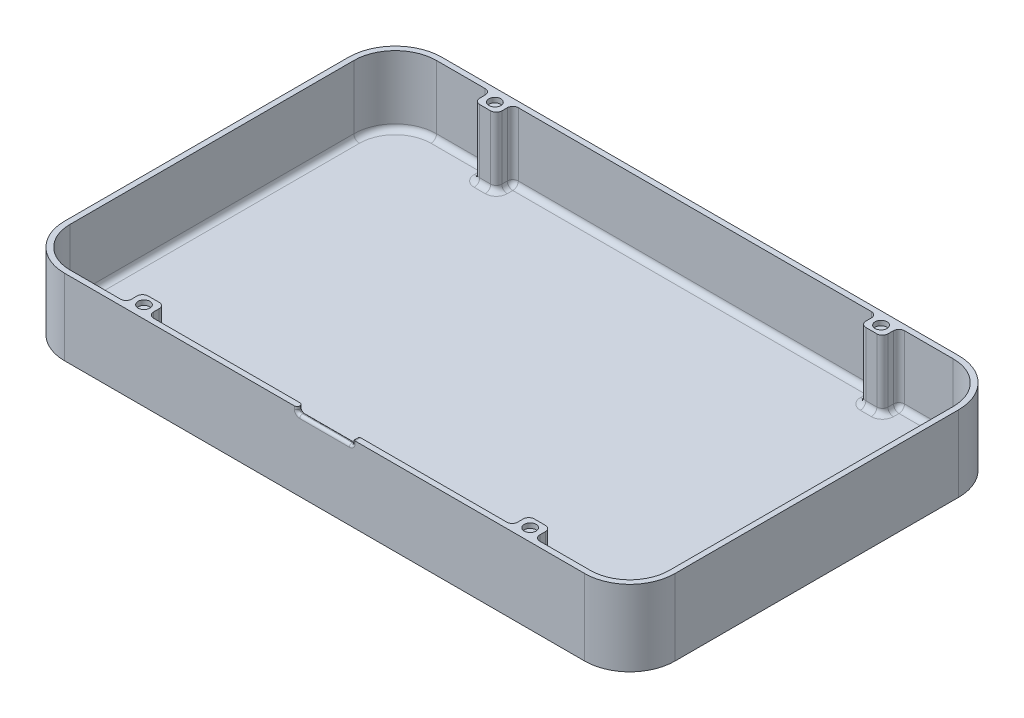
from build123d import *

# Parameters (mm, degrees)
SKETCH1_W                = 201.28
SKETCH1_H                = 116.21
BOSS_EXTRUDE1_DEPTH      = 2.5
FILLET1_R                = 6.98
FILLET2_R                = 6.35
BOSS_EXTRUDE3_DEPTH      = 2.5
BOSS_EXTRUDE4_DEPTH      = 25
CUT_EXTRUDE2_DEPTH       = 25
SKETCH6_W                = 8
SKETCH6_H                = 8
BOSS_EXTRUDE5_DEPTH      = 25
SKETCH7_R                = 2.15
CUT_EXTRUDE3_DEPTH       = 1.75
SKETCH9_R                = 2.15
CUT_EXTRUDE4_DEPTH       = 1.75
FILLET3_R                = 2
FILLET4_R                = 2
FILLET3_OF_MIRROR5_R     = 2
FILLET4_OF_MIRROR5_R     = 2
SKETCH10_W               = 20
SKETCH10_H               = 2
CUT_EXTRUDE5_DEPTH       = 2
FILLET5_R                = 1
FILLET6_R                = 2
CUT_EXTRUDE7_START       = -0.45
CUT_EXTRUDE7_OUTLINE_R   = 5.190797436
CUT_EXTRUDE7_DEPTH       = 0.45
CUT_EXTRUDE8_START       = -0.45
CUT_EXTRUDE8_OUTLINE_W   = 5.775616108
CUT_EXTRUDE8_OUTLINE_H   = 32.832520325
CUT_EXTRUDE8_OUTLINE_H_2 = 20.344721798
CUT_EXTRUDE8_DEPTH       = 0.45


# Read off the part's stored shape, not the designer's step: Cut-Extrude7, Cut-Extrude8
with BuildPart() as part:
    # Sketch1 → Boss-Extrude1 (new body)
    with BuildSketch(Plane(origin=(0, 0, 0), x_dir=(1, 0, 0), z_dir=(0, 1, 0))):
        with Locations((-100.64, 58.105)):
            Rectangle(SKETCH1_W, SKETCH1_H)
    extrude(amount=-BOSS_EXTRUDE1_DEPTH)

    # Fillet1
    fillet1_edges = [part.edges().sort_by_distance(p)[0] for p in [
        (-201.28, -1.25, -116.21),
        (0, -1.25, -116.21),
    ]]
    fillet(fillet1_edges, radius=FILLET1_R)

    # Fillet2
    fillet2_edges = [part.edges().sort_by_distance(p)[0] for p in [
        (0, -1.25, 0),
        (-201.28, -1.25, 0),
    ]]
    fillet(fillet2_edges, radius=FILLET2_R)

    # Sketch2 → Boss-Extrude3 (add)
    with BuildSketch(Plane(origin=(0, -2.5, 0), x_dir=(-1, 0, 0), z_dir=(0, -1, 0))):
        with BuildLine():
            Line((6.35, -10), (194.93, -10))
            ThreePointArc((194.93, -10), (206.491195872, -5.211195872), (211.28, 6.35))
            Line((211.28, 6.35), (211.28, 109.23))
            ThreePointArc((211.28, 109.23), (206.306673145, 121.236673145), (194.3, 126.21))
            Line((194.3, 126.21), (6.98, 126.21))
            ThreePointArc((6.98, 126.21), (-5.026673145, 121.236673145), (-10, 109.23))
            Line((-10, 109.23), (-10, 6.35))
            ThreePointArc((-10, 6.35), (-5.211195872, -5.211195872), (6.35, -10))
        make_face()
        with BuildLine():
            Line((6.35, 0), (194.93, 0))
            ThreePointArc((194.93, 0), (199.420128061, 1.859871939), (201.28, 6.35))
            Line((201.28, 6.35), (201.28, 109.23))
            ThreePointArc((201.28, 109.23), (199.235605333, 114.165605333), (194.3, 116.21))
            Line((194.3, 116.21), (6.98, 116.21))
            ThreePointArc((6.98, 116.21), (2.044394667, 114.165605333), (0, 109.23))
            Line((0, 109.23), (0, 6.35))
            ThreePointArc((0, 6.35), (1.859871939, 1.859871939), (6.35, 0))
        make_face(mode=Mode.SUBTRACT)
    extrude(amount=-BOSS_EXTRUDE3_DEPTH)

    # Sketch4 → Boss-Extrude4 (add)
    with BuildSketch(Plane(origin=(0, 0, 0), x_dir=(1, 0, 0), z_dir=(0, 1, 0))):
        with BuildLine():
            Line((10, 6.35), (10, 109.23))
            ThreePointArc((10, 109.23), (5.026673145, 121.236673145), (-6.98, 126.21))
            Line((-6.98, 126.21), (-194.3, 126.21))
            ThreePointArc((-194.3, 126.21), (-206.306673145, 121.236673145), (-211.28, 109.23))
            Line((-211.28, 109.23), (-211.28, 6.35))
            ThreePointArc((-211.28, 6.35), (-206.491195872, -5.211195872), (-194.93, -10))
            Line((-194.93, -10), (-6.35, -10))
            ThreePointArc((-6.35, -10), (5.211195872, -5.211195872), (10, 6.35))
        make_face()
    extrude(amount=BOSS_EXTRUDE4_DEPTH)

    # Sketch5 → Cut-Extrude2 (cut)
    with BuildSketch(Plane(origin=(0, 25, 0), x_dir=(1, 0, 0), z_dir=(0, 1, 0))):
        with BuildLine():
            Line((8, 6.35), (8, 109.23))
            ThreePointArc((8, 109.23), (3.612459582, 119.822459582), (-6.98, 124.21))
            Line((-6.98, 124.21), (-194.3, 124.21))
            ThreePointArc((-194.3, 124.21), (-204.892459582, 119.822459582), (-209.28, 109.23))
            Line((-209.28, 109.23), (-209.28, 6.35))
            ThreePointArc((-209.28, 6.35), (-205.07698231, -3.79698231), (-194.93, -8))
            Line((-194.93, -8), (-6.35, -8))
            ThreePointArc((-6.35, -8), (3.79698231, -3.79698231), (8, 6.35))
        make_face()
    extrude(amount=-CUT_EXTRUDE2_DEPTH, mode=Mode.SUBTRACT)

    # Sketch6 → Boss-Extrude5 (add)
    with BuildSketch(Plane(origin=(0, 0, 0), x_dir=(1, 0, 0), z_dir=(0, 1, 0))):
        with Locations((-170.64, -6)):
            Rectangle(SKETCH6_W, SKETCH6_H)
        with Locations((-170.64, 122.21)):
            Rectangle(SKETCH6_W, SKETCH6_H)
    boss_extrude5 = extrude(amount=BOSS_EXTRUDE5_DEPTH)

    # Sketch7 → Cut-Extrude3 (cut)
    with BuildSketch(Plane(origin=(0, 25, 0), x_dir=(1, 0, 0), z_dir=(0, 1, 0))):
        with Locations(Location((-170.64, 121.71, 0), (0, 0, 270))):
            Circle(SKETCH7_R)
    cut_extrude3 = extrude(amount=-CUT_EXTRUDE3_DEPTH, mode=Mode.SUBTRACT)

    # Sketch9 → Cut-Extrude4 (cut)
    with BuildSketch(Plane(origin=(0, 25, 0), x_dir=(1, 0, 0), z_dir=(0, 1, 0))):
        with Locations(Location((-170.64, -5.5, 0), (0, 0, 270))):
            Circle(SKETCH9_R)
    cut_extrude4 = extrude(amount=-CUT_EXTRUDE4_DEPTH, mode=Mode.SUBTRACT)

    # Fillet3
    fillet3_edges = [part.edges().sort_by_distance(p)[0] for p in [
        (-166.64, 12.5, -124.21),
        (-174.64, 12.5, -124.21),
        (-166.64, 12.5, -118.21),
        (-174.64, 12.5, -118.21),
    ]]
    fillet(fillet3_edges, radius=FILLET3_R)

    # Fillet4
    fillet4_edges = [part.edges().sort_by_distance(p)[0] for p in [
        (-166.64, 12.5, 8),
        (-174.64, 12.5, 8),
        (-174.64, 12.5, 2),
        (-166.64, 12.5, 2),
    ]]
    fillet(fillet4_edges, radius=FILLET4_R)

    # Mirror5: Boss-Extrude5, Cut-Extrude3, Cut-Extrude4 across plane
    add(boss_extrude5.mirror(Plane(origin=(-100.64, 0, 0), x_dir=(0, 0, 1), z_dir=(1, 0, 0))))
    add(cut_extrude3.mirror(Plane(origin=(-100.64, 0, 0), x_dir=(0, 0, 1), z_dir=(1, 0, 0))), mode=Mode.SUBTRACT)
    add(cut_extrude4.mirror(Plane(origin=(-100.64, 0, 0), x_dir=(0, 0, 1), z_dir=(1, 0, 0))), mode=Mode.SUBTRACT)

    # Fillet3 of Mirror5
    fillet3_of_mirror5_edges = [part.edges().sort_by_distance(p)[0] for p in [
        (-34.64, 12.5, -124.21),
        (-26.64, 12.5, -124.21),
        (-34.64, 12.5, -118.21),
        (-26.64, 12.5, -118.21),
    ]]
    fillet(fillet3_of_mirror5_edges, radius=FILLET3_OF_MIRROR5_R)

    # Fillet4 of Mirror5
    fillet4_of_mirror5_edges = [part.edges().sort_by_distance(p)[0] for p in [
        (-34.64, 12.5, 8),
        (-26.64, 12.5, 8),
        (-26.64, 12.5, 2),
        (-34.64, 12.5, 2),
    ]]
    fillet(fillet4_of_mirror5_edges, radius=FILLET4_OF_MIRROR5_R)

    # Sketch10 → Cut-Extrude5 (cut)
    with BuildSketch(Plane(origin=(0, 25, 0), x_dir=(1, 0, 0), z_dir=(0, 1, 0))):
        with Locations((-100.64, -9)):
            Rectangle(SKETCH10_W, SKETCH10_H)
    extrude(amount=-CUT_EXTRUDE5_DEPTH, mode=Mode.SUBTRACT)

    # Fillet5
    fillet5_edges = [part.edges().sort_by_distance(p)[0] for p in [
        (-110.64, 23, 9),
        (-110.64, 24, 10),
        (-100.64, 23, 8),
        (-110.64, 24, 8),
        (-90.64, 23, 9),
        (-90.64, 24, 8),
        (-100.64, 23, 10),
        (-90.64, 24, 10),
        (-90.64, 25, 9),
    ]]
    fillet(fillet5_edges, radius=FILLET5_R - 0.0001)  # a hair under: the kernel refuses the full size

    # Fillet6
    fillet6_edges = [part.edges().sort_by_distance(p)[0] for p in [
        (-185.785, 0, 8),
        (-205.07698231, 0, 3.79698231),
        (-209.28, 0, -57.79),
        (-204.892459582, 0, -119.822459582),
        (-15.81, 0, -124.21),
        (3.612459582, 0, -119.822459582),
        (8, 0, -57.79),
        (-174.64, 0, -121.21),
        (-170.64, 0, -118.21),
        (-185.47, 0, -124.21),
        (-166.64, 0, -121.21),
        (-166.054213562, 0, -123.624213562),
        (-175.225786438, 0, -123.624213562),
        (-174.054213562, 0, -118.795786438),
        (-167.225786438, 0, -118.795786438),
        (-174.64, 0, 5),
        (-170.64, 0, 2),
        (-166.64, 0, 5),
        (-100.64, 0, 8),
        (-166.054213562, 0, 7.414213562),
        (-175.225786438, 0, 7.414213562),
        (-174.054213562, 0, 2.585786438),
        (-167.225786438, 0, 2.585786438),
        (-26.64, 0, -121.21),
        (-30.64, 0, -118.21),
        (-34.64, 0, -121.21),
        (-100.64, 0, -124.21),
        (-35.225786438, 0, -123.624213562),
        (-26.054213562, 0, -123.624213562),
        (-27.225786438, 0, -118.795786438),
        (-34.054213562, 0, -118.795786438),
        (-15.495, 0, 8),
        (-26.64, 0, 5),
        (-34.64, 0, 5),
        (-30.64, 0, 2),
        (-35.225786438, 0, 7.414213562),
        (-26.054213562, 0, 7.414213562),
        (-27.225786438, 0, 2.585786438),
        (-34.054213562, 0, 2.585786438),
        (3.79698231, 0, 3.79698231),
    ]]
    fillet(fillet6_edges, radius=FILLET6_R)

    # Cut-Extrude7 outline → Cut-Extrude7 (cut)
    with BuildSketch(Plane.XZ.offset(2.5).offset(CUT_EXTRUDE7_START)):
        with BuildLine():
            add(Edge.make_bspline(
                [(-135.335021069, -68.509429841), (-136.902942436, -67.967883827), (-138.138308084, -66.510804787)],
                knots=[0.471458165, 0.471458165, 0.471458165, 1, 1, 1], degree=2))
            ThreePointArc((-135.335021069, -68.509429841), (-122.182388188, -58.219638212), (-135.304911995, -47.89147611))
            add(Edge.make_bspline(
                [(-135.304911995, -47.89147611), (-137.037610151, -48.257830638), (-138.138308084, -49.594184915)],
                knots=[0, 0, 0, 1, 1, 1], degree=2))
            Line((-138.138308084, -49.594184915), (-138.138308084, -48.055987377))
            Line((-138.138308084, -48.055987377), (-143.499525592, -48))
            Line((-143.499525592, -48), (-143.499525592, -68.305651136))
            Line((-143.499525592, -68.305651136), (-138.138308084, -68.305651136))
            Line((-138.138308084, -68.305651136), (-138.138308084, -66.510804787))
        make_face()
        with Locations((-132.910364857, -58.178026107)):
            Circle(CUT_EXTRUDE7_OUTLINE_R, mode=Mode.SUBTRACT)
    extrude(amount=CUT_EXTRUDE7_DEPTH, mode=Mode.SUBTRACT)

    # Cut-Extrude8 outline → Cut-Extrude8 (cut)
    # profile 1 of 7: a face of its own
    with BuildSketch(Plane.XZ.offset(2.5).offset(CUT_EXTRUDE8_START)):
        with BuildLine():
            Line((-153.895284553, -49.686686992), (-154.125689787, -49.461458333))
            add(Edge.make_bspline(
                [(-154.125689787, -49.461458333), (-154.333312342, -49.277271532), (-154.73497788, -48.920944683), (-155.384487301, -48.481747367), (-156.045267971, -48.142829792), (-156.721127319, -47.917706071), (-157.393020794, -47.77449684), (-158.050742932, -47.66904282), (-158.696238638, -47.605292289), (-159.122361376, -47.608176561), (-159.332848359, -47.6097099)],
                knots=[0, 0, 0, 0, 0.14624792, 0.282930482, 0.412301175, 0.536684676, 0.657355034, 0.774278195, 0.887941275, 0.998886329, 0.998886329, 0.998886329, 0.998886329], degree=3))
            add(Edge.make_bspline(
                [(-159.332848359, -47.6097099), (-159.695257047, -47.620844346), (-160.414247039, -47.642855132), (-161.478426635, -47.785641026), (-162.511050356, -48.037539669), (-163.51273552, -48.37519474), (-164.478530924, -48.799443636), (-165.383913378, -49.3368487), (-166.251254093, -49.941576965), (-166.771876888, -50.419833231), (-167.033495935, -50.660162602)],
                knots=[0, 0, 0, 0, 0.128061852, 0.254064318, 0.378555642, 0.503075247, 0.627217234, 0.750462499, 0.874604486, 1, 1, 1, 1], degree=3))
            add(Edge.make_bspline(
                [(-167.033495935, -50.660162602), (-167.275083253, -50.920153984), (-167.753245981, -51.434743037), (-168.374002255, -52.28126438), (-168.898668434, -53.175484814), (-169.347125364, -54.106030348), (-169.686619543, -55.076441077), (-169.946136959, -56.06921193), (-170.098116552, -57.090165798), (-170.118937903, -57.779458069), (-170.129430894, -58.126829268)],
                knots=[0, 0, 0, 0, 0.128388323, 0.254113136, 0.37901229, 0.503276211, 0.627383917, 0.750532671, 0.874280086, 1, 1, 1, 1], degree=3))
            add(Edge.make_bspline(
                [(-170.129430894, -58.126829268), (-170.11899702, -58.474216491), (-170.098292975, -59.163540559), (-169.945133687, -60.186341912), (-169.688050051, -61.181968268), (-169.345518404, -62.155568354), (-168.899173091, -63.091301178), (-168.372255424, -63.992628152), (-167.753812481, -64.851309562), (-167.275200179, -65.374704463), (-167.033495935, -65.63902439)],
                knots=[0, 0, 0, 0, 0.125145805, 0.248328119, 0.371671333, 0.495212293, 0.61961469, 0.744616561, 0.871028678, 1, 1, 1, 1], degree=3))
            add(Edge.make_bspline(
                [(-167.033495935, -65.63902439), (-166.776187157, -65.883388974), (-166.264594334, -66.369245571), (-165.411457542, -66.990779233), (-164.508114148, -67.531913326), (-163.547030411, -67.970119392), (-162.54087271, -68.317628359), (-161.501152685, -68.56124905), (-160.43010275, -68.71811497), (-159.70613274, -68.737926144), (-159.339186992, -68.74796748)],
                knots=[0, 0, 0, 0, 0.124863035, 0.248258272, 0.37082862, 0.495193376, 0.619551099, 0.745119547, 0.870813298, 1, 1, 1, 1], degree=3))
            add(Edge.make_bspline(
                [(-159.339186992, -68.74796748), (-159.098233335, -68.741442242), (-158.6232666, -68.728579723), (-157.920002587, -68.634359669), (-157.234193034, -68.481727747), (-156.573684206, -68.248630614), (-155.925913249, -67.969407759), (-155.303514118, -67.617138371), (-154.701609793, -67.19690446), (-154.322271787, -66.879868241), (-154.129430894, -66.718699187)],
                knots=[0, 0, 0, 0, 0.126308856, 0.248979433, 0.37141804, 0.494004315, 0.615659408, 0.740868788, 0.868267631, 1, 1, 1, 1], degree=3))
            Line((-154.129430894, -66.718699187), (-153.895284553, -66.53624873))
            Line((-153.895284553, -66.53624873), (-153.895284553, -80.858530234))
            Line((-153.895284553, -80.858530234), (-148.535928608, -80.858530234))
            Line((-148.535928608, -80.858530234), (-148.535928608, -48.06504065))
            Line((-148.535928608, -48.06504065), (-153.895284553, -48.06504065))
            Line((-153.895284553, -48.06504065), (-153.895284553, -49.686686992))
        make_face()
        with BuildLine():
            add(Edge.make_bspline(
                [(-164.770081301, -58.126829268), (-164.760316498, -57.950904711), (-164.740926284, -57.60156692), (-164.655373424, -57.089620397), (-164.52575302, -56.599239645), (-164.348121474, -56.129930789), (-164.119751135, -55.685381599), (-163.851889919, -55.255495568), (-163.530105473, -54.852947303), (-163.168229264, -54.473025878), (-162.776600068, -54.120966141), (-162.347767411, -53.821089297), (-161.898632309, -53.561937817), (-161.431423855, -53.337066778), (-160.939471941, -53.168745794), (-160.427375075, -53.046339235), (-159.892684639, -52.958013874), (-159.525986618, -52.93950825), (-159.339186992, -52.930081301)],
                knots=[0, 0, 0, 0, 0.063512842, 0.126119038, 0.186815983, 0.246214583, 0.306714762, 0.366809304, 0.428604473, 0.492213517, 0.555918619, 0.618186944, 0.680553391, 0.742816805, 0.80488842, 0.867665305, 0.932587388, 1, 1, 1, 1], degree=3))
            add(Edge.make_bspline(
                [(-159.339186992, -52.930081301), (-159.152348434, -52.939386398), (-158.785573985, -52.957652821), (-158.249353829, -53.048053234), (-157.732521455, -53.164985369), (-157.243840587, -53.347495156), (-156.769585255, -53.558940127), (-156.324184425, -53.828565149), (-155.896952068, -54.134038226), (-155.503664294, -54.485975085), (-155.139754414, -54.866520261), (-154.819947924, -55.275315652), (-154.552357425, -55.711593006), (-154.32144857, -56.163971881), (-154.149472604, -56.644341643), (-154.007624103, -57.140466749), (-153.92642804, -57.651059178), (-153.906590014, -57.995202288), (-153.897485992, -58.163927762)],
                knots=[0, 0, 0, 0, 0.066807777, 0.131147369, 0.194114214, 0.255887083, 0.317264953, 0.379464114, 0.441624642, 0.504758173, 0.567796508, 0.629647103, 0.689859339, 0.750508838, 0.810825709, 0.871929, 0.934738278, 0.99511549, 0.99511549, 0.99511549, 0.99511549], degree=3))
            add(Edge.make_bspline(
                [(-153.897485992, -58.163927762), (-153.906454184, -58.33396152), (-153.926010164, -58.679430985), (-154.008712508, -59.19309619), (-154.148009442, -59.692144681), (-154.323022266, -60.175672969), (-154.552121848, -60.63304935), (-154.819816086, -61.07579041), (-155.139678389, -61.49092748), (-155.503124509, -61.878689639), (-155.899237537, -62.235247174), (-156.31973204, -62.55715416), (-156.771865211, -62.822390691), (-157.241795232, -63.0451449), (-157.73383988, -63.222651674), (-158.248201054, -63.351041996), (-158.785742397, -63.438454499), (-159.152405271, -63.457145357), (-159.339186992, -63.466666667)],
                knots=[0.004968939, 0.004968939, 0.004968939, 0.004968939, 0.065453541, 0.127900629, 0.189394563, 0.249363617, 0.310353494, 0.370874361, 0.432978279, 0.496214164, 0.55949697, 0.622214404, 0.684054894, 0.745403852, 0.806820508, 0.869608891, 0.93357747, 1, 1, 1, 1], degree=3))
            add(Edge.make_bspline(
                [(-159.339186992, -63.466666667), (-159.525954275, -63.457088283), (-159.892588806, -63.438285384), (-160.428257084, -63.352019152), (-160.939885591, -63.221442709), (-161.430107793, -63.045276685), (-161.899995821, -62.822355113), (-162.352140096, -62.557163818), (-162.772632571, -62.235244756), (-163.168742371, -61.878689492), (-163.532203388, -61.490930467), (-163.852010766, -61.075778972), (-164.119904885, -60.633091153), (-164.348260997, -60.175516538), (-164.525838662, -59.693248187), (-164.654515178, -59.191948498), (-164.741876272, -58.667328568), (-164.760560364, -58.30928113), (-164.770081301, -58.126829268)],
                knots=[0, 0, 0, 0, 0.066523179, 0.130588689, 0.192724454, 0.254234175, 0.315676094, 0.377610291, 0.440422759, 0.503801458, 0.567133164, 0.629331187, 0.689943761, 0.751026055, 0.81108598, 0.872474575, 0.935016289, 1, 1, 1, 1], degree=3))
        make_face(mode=Mode.SUBTRACT)
    # profile 2 of 7: a face of its own
    with BuildSketch(Plane.XZ.offset(2.5).offset(CUT_EXTRUDE8_START)):
        with BuildLine():
            add(Edge.make_bspline(
                [(-68.106666667, -58.909711636), (-68.129710764, -59.190661421), (-68.174679977, -59.73891855), (-68.440052992, -60.520993447), (-68.857585572, -61.228455213), (-69.42016018, -61.846433122), (-70.083157757, -62.37237346), (-70.847665248, -62.739220964), (-71.672154174, -62.996335565), (-72.252078548, -63.032099082), (-72.548943089, -63.050406504)],
                knots=[0, 0, 0, 0, 0.125621058, 0.245142173, 0.365477751, 0.490385963, 0.616777914, 0.741166222, 0.86750243, 1, 1, 1, 1], degree=3))
            add(Edge.make_bspline(
                [(-72.548943089, -63.050406504), (-72.852044538, -63.031420544), (-73.441542597, -62.994494998), (-74.280332367, -62.750214031), (-75.045755068, -62.379343718), (-75.705621684, -61.854160315), (-76.258253155, -61.225105747), (-76.659972283, -60.494776244), (-76.916832724, -59.684776086), (-76.957388618, -59.11520251), (-76.978211382, -58.822764228)],
                knots=[0, 0, 0, 0, 0.133507961, 0.259657895, 0.382317105, 0.506198751, 0.628824451, 0.749028085, 0.871142555, 1, 1, 1, 1], degree=3))
            Line((-76.978211382, -58.822764228), (-76.97820503, -48.026009909))
            Line((-76.97820503, -48.026009909), (-82.675766006, -48.026009909))
            Line((-82.675766006, -48.026009909), (-82.675766006, -58.821011179))
            add(Edge.make_bspline(
                [(-82.675766006, -58.821011179), (-82.667650648, -59.145188512), (-82.651463182, -59.791815518), (-82.501332244, -60.748391591), (-82.269133944, -61.686453936), (-81.933634678, -62.594741291), (-81.51937627, -63.477701887), (-81.008088846, -64.314820733), (-80.420367325, -65.117956521), (-79.970499219, -65.610478877), (-79.742439024, -65.860162602)],
                knots=[0, 0, 0, 0, 0.124303602, 0.247944744, 0.370608249, 0.494551228, 0.618828722, 0.744225855, 0.870335549, 1, 1, 1, 1], degree=3))
            add(Edge.make_bspline(
                [(-79.742439024, -65.860162602), (-79.497437008, -66.084328339), (-79.011642093, -66.528808662), (-78.208554747, -67.102150303), (-77.359739257, -67.598852074), (-76.463640255, -68.016146074), (-75.52580449, -68.33967828), (-74.55964089, -68.57666051), (-73.56315596, -68.714047801), (-72.889730956, -68.736570055), (-72.548943089, -68.74796748)],
                knots=[0, 0, 0, 0, 0.12529289, 0.248433257, 0.371704161, 0.496229873, 0.621013626, 0.745700675, 0.871311395, 1, 1, 1, 1], degree=3))
            add(Edge.make_bspline(
                [(-72.548943089, -68.74796748), (-72.358006624, -68.750215945), (-71.976812855, -68.754704879), (-71.405735574, -68.681970951), (-70.843712268, -68.532393548), (-70.280059775, -68.334557906), (-69.728738814, -68.055103254), (-69.176173304, -67.721555771), (-68.630258154, -67.317935919), (-68.284144508, -67.007806552), (-68.106666667, -66.848780488)],
                knots=[0, 0, 0, 0, 0.115304635, 0.230199131, 0.346504339, 0.466277981, 0.590498043, 0.719250988, 0.856039398, 1, 1, 1, 1], degree=3))
            Line((-68.106666667, -66.848780488), (-68.106666667, -68.370731707))
            Line((-68.106666667, -68.370731707), (-62.409099339, -68.370731707))
            Line((-62.409099339, -68.370731707), (-62.409099339, -48.026009909))
            Line((-62.409099339, -48.026009909), (-68.106666667, -48.026009909))
            Line((-68.106666667, -48.026009909), (-68.106666667, -58.909711636))
        make_face()
    # profile 3 of 7: a face of its own
    with BuildSketch(Plane.XZ.offset(2.5).offset(CUT_EXTRUDE8_START)):
        with BuildLine():
            add(Edge.make_bspline(
                [(-51.365203252, -76.871544715), (-51.207313002, -76.704346103), (-50.897582929, -76.376356006), (-50.577830439, -75.778445752), (-50.373005006, -75.128710538), (-50.345263026, -74.672593062), (-50.331056911, -74.43902439)],
                knots=[0, 0, 0, 0, 0.253167237, 0.496632988, 0.742235783, 1, 1, 1, 1], degree=3))
            add(Edge.make_bspline(
                [(-50.331056911, -74.43902439), (-50.348244818, -74.20354439), (-50.381795127, -73.743894107), (-50.580664373, -73.086625431), (-50.910359605, -72.495800948), (-51.343695009, -71.972430849), (-51.866724786, -71.53488683), (-52.468407875, -71.218939557), (-53.094001694, -71.018107859), (-53.52328386, -70.98107471), (-53.72661891, -70.966842791)],
                knots=[0, 0, 0, 0, 0.129163845, 0.252124162, 0.372887392, 0.497836722, 0.622786052, 0.744028017, 0.86847314, 0.979891323, 0.979891323, 0.979891323, 0.979891323], degree=3))
            add(Edge.make_bspline(
                [(-53.72661891, -70.966842791), (-53.946990897, -70.980634067), (-54.407931703, -71.016893198), (-55.077838725, -71.218123789), (-55.717961167, -71.528518409), (-56.262541436, -71.970760415), (-56.712360984, -72.491561092), (-57.038456191, -73.088269355), (-57.248363312, -73.742492842), (-57.280479944, -74.203286073), (-57.296910569, -74.43902439)],
                knots=[0.021941327, 0.021941327, 0.021941327, 0.021941327, 0.13905187, 0.267516357, 0.391288649, 0.515195169, 0.637899183, 0.755059118, 0.874690105, 1, 1, 1, 1], degree=3))
            add(Edge.make_bspline(
                [(-57.296910569, -74.43902439), (-57.279504326, -74.672277578), (-57.245374886, -75.129630763), (-57.047725916, -75.785299587), (-56.716761096, -76.373120381), (-56.293925771, -76.900127898), (-55.770076129, -77.32734608), (-55.1828344, -77.65624306), (-54.527404156, -77.854224871), (-54.07001798, -77.888308287), (-53.836747967, -77.905691057)],
                knots=[0, 0, 0, 0, 0.129160067, 0.253251707, 0.375126045, 0.500463826, 0.624873955, 0.746748293, 0.870839933, 1, 1, 1, 1], degree=3))
            add(Edge.make_bspline(
                [(-53.836747967, -77.905691057), (-53.60323239, -77.893936261), (-53.144937754, -77.870866451), (-52.48753368, -77.665286738), (-51.881480021, -77.337224794), (-51.539504419, -77.028763839), (-51.365203252, -76.871544715)],
                knots=[0, 0, 0, 0, 0.254250524, 0.498988773, 0.744640142, 1, 1, 1, 1], degree=3))
        make_face()
    # profile 4 of 7: a face of its own
    with BuildSketch(Plane.XZ.offset(2.5).offset(CUT_EXTRUDE8_START)):
        with BuildLine():
            add(Edge.make_bspline(
                [(-33.652874746, -55.392441565), (-33.662549893, -55.145926771), (-33.681582654, -54.660987664), (-33.777591879, -53.94392554), (-33.95106021, -53.255583293), (-34.173759254, -52.587321812), (-34.479999837, -51.951795814), (-34.8453452, -51.341749418), (-35.267230465, -50.747922279), (-35.599539972, -50.387886715), (-35.768455285, -50.204878049)],
                knots=[0, 0, 0, 0, 0.128786836, 0.253346959, 0.376905006, 0.498986513, 0.620520896, 0.744389729, 0.870071461, 1, 1, 1, 1], degree=3))
            add(Edge.make_bspline(
                [(-35.768455285, -50.204878049), (-35.947070151, -50.03597001), (-36.298189092, -49.703932631), (-36.879314496, -49.282480891), (-37.478567004, -48.912679941), (-38.113392154, -48.611971038), (-38.779622602, -48.38056517), (-39.472309814, -48.199762283), (-40.197025374, -48.098373183), (-40.689585963, -48.076250924), (-40.939186992, -48.06504065)],
                knots=[0, 0, 0, 0, 0.128338935, 0.252287125, 0.374309719, 0.495937203, 0.618484627, 0.742412104, 0.869469452, 1, 1, 1, 1], degree=3))
            Line((-40.939186992, -48.06504065), (-46.330694868, -48.06504065))
            Line((-46.330694868, -48.06504065), (-44.892076982, -53.346341463))
            Line((-44.892076982, -53.346341463), (-40.980834604, -53.346341463))
            add(Edge.make_bspline(
                [(-40.980834604, -53.346341463), (-40.855204194, -53.357962466), (-40.604752714, -53.381129607), (-40.247990429, -53.51907244), (-39.916891476, -53.726346779), (-39.615874719, -53.997275435), (-39.358292397, -54.316573489), (-39.162454929, -54.676822439), (-39.04524042, -55.071749533), (-39.020188508, -55.346697685), (-39.007479675, -55.486178862)],
                knots=[0, 0, 0, 0, 0.118313142, 0.235864085, 0.355957628, 0.484627877, 0.615338471, 0.740462135, 0.868336461, 1, 1, 1, 1], degree=3))
            Line((-39.007479675, -55.486178862), (-39.00273501, -63.843896087))
            Line((-39.00273501, -63.843896087), (-44.9819906, -63.843896087))
            Line((-44.9819906, -63.843896087), (-44.9819906, -68.370725356))
            Line((-44.9819906, -68.370725356), (-39.00273501, -68.370725356))
            Line((-39.00273501, -68.370725356), (-39.00273501, -76.695928608))
            Line((-39.00273501, -76.695928608), (-33.652874746, -76.695928608))
            Line((-33.652874746, -76.695928608), (-33.652874746, -68.370725356))
            Line((-33.652874746, -68.370725356), (-30.775638974, -68.370725356))
            Line((-30.775638974, -68.370725356), (-30.775638974, -63.843896087))
            Line((-30.775638974, -63.843896087), (-33.652874746, -63.843896087))
            Line((-33.652874746, -63.843896087), (-33.652874746, -55.392441565))
        make_face()
    # profile 5 of 7: a face of its own
    with BuildSketch(Plane.XZ.offset(2.5).offset(CUT_EXTRUDE8_START)):
        with Locations((-114.792842353, -64.442270072)):
            Rectangle(CUT_EXTRUDE8_OUTLINE_W, CUT_EXTRUDE8_OUTLINE_H)
    # profile 6 of 7: a face of its own
    with BuildSketch(Plane.XZ.offset(2.5).offset(CUT_EXTRUDE8_START)):
        with Locations((-53.60259845, -58.198370808)):
            Rectangle(CUT_EXTRUDE8_OUTLINE_W, CUT_EXTRUDE8_OUTLINE_H_2)
    # profile 7 of 7: a face of its own
    with BuildSketch(Plane.XZ.offset(2.5).offset(CUT_EXTRUDE8_START)):
        Polygon((-94.173130081, -47.819213669), (-89.272837907, -35.954471545), (-95.162179878, -35.954471545), (-108.289568089, -68.370731707), (-102.3103125, -68.370731707), (-97.095322663, -55.60964812), (-91.970246443, -68.370731707), (-85.946034045, -68.370731707), align=None)
    extrude(amount=CUT_EXTRUDE8_DEPTH, mode=Mode.SUBTRACT)


solid = part.part
